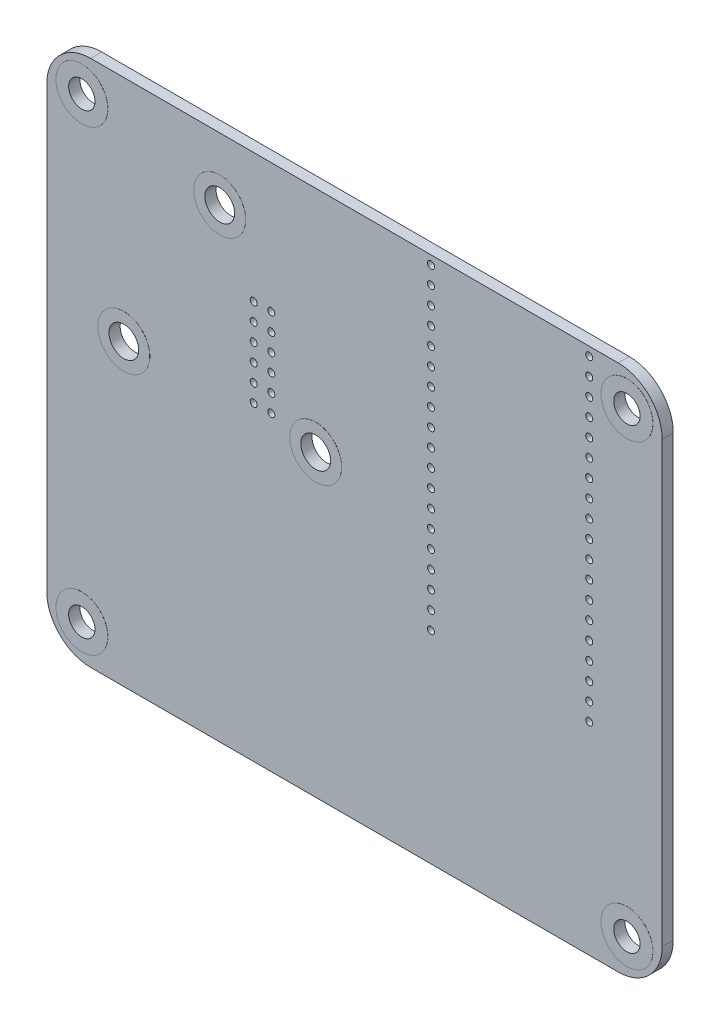
from build123d import *

# Parameters (mm, degrees)
SKETCH1_W           = 88.9
SKETCH1_H           = 76.2
BOSS_EXTRUDE1_DEPTH = 1.6
SKETCH2_R           = 2.15
CUT_EXTRUDE1_DEPTH  = 118.099146026
SKETCH4_R           = 1.905
CUT_EXTRUDE2_DEPTH  = 118.099146026
FILLET1_R           = 6.35
BOSS_EXTRUDE2_START = 0.01
SKETCH6_R           = 3.75
SKETCH6_R_2         = 1.905
SKETCH6_R_3         = 2.15
BOSS_EXTRUDE2_DEPTH = 0.01
SKETCH7_R           = 0.508
CUT_EXTRUDE3_DEPTH  = 118.099283089


with BuildPart() as part:
    # Sketch1 → Boss-Extrude1 (new body)
    with BuildSketch(Plane.XY):
        with Locations((44.45, -38.1)):
            Rectangle(SKETCH1_W, SKETCH1_H)
    extrude(amount=BOSS_EXTRUDE1_DEPTH)

    # Sketch2 → Cut-Extrude1 (cut, through all)
    with BuildSketch(Plane(origin=(0, 0, 0), x_dir=(-1, 0, 0), z_dir=(0, 0, -1))):
        with Locations((-38.856406461, -33)):
            Circle(SKETCH2_R)
        with Locations((-11.143593539, -33)):
            Circle(SKETCH2_R)
        with Locations((-25, -9)):
            Circle(SKETCH2_R)
    extrude(amount=-CUT_EXTRUDE1_DEPTH, mode=Mode.SUBTRACT)

    # Sketch4 → Cut-Extrude2 (cut, through all)
    with BuildSketch(Plane(origin=(0, 0, 0), x_dir=(-1, 0, 0), z_dir=(0, 0, -1))):
        with Locations((-5.08, -5.08)):
            Circle(SKETCH4_R)
        with Locations((-83.82, -5.08)):
            Circle(SKETCH4_R)
        with Locations((-83.82, -71.12)):
            Circle(SKETCH4_R)
        with Locations((-5.08, -71.12)):
            Circle(SKETCH4_R)
    extrude(amount=-CUT_EXTRUDE2_DEPTH, mode=Mode.SUBTRACT)

    # Fillet1
    fillet1_edges = [part.edges().sort_by_distance(p)[0] for p in [
        (88.9, 0, 0.8),
        (88.9, -76.2, 0.8),
        (0, -76.2, 0.8),
        (0, 0, 0.8),
    ]]
    fillet(fillet1_edges, radius=FILLET1_R)

    # Sketch6 → Boss-Extrude2 (add)
    # profile 1 of 7: a face of its own
    with BuildSketch(Plane(origin=(0, 0, 0), x_dir=(-1, 0, 0), z_dir=(0, 0, -1)).offset(BOSS_EXTRUDE2_START)):
        with Locations((-5.08, -71.12)):
            Circle(SKETCH6_R)
        with Locations((-5.08, -71.12)):
            Circle(SKETCH6_R_2, mode=Mode.SUBTRACT)
    # profile 2 of 7: a face of its own
    with BuildSketch(Plane(origin=(0, 0, 0), x_dir=(-1, 0, 0), z_dir=(0, 0, -1)).offset(BOSS_EXTRUDE2_START)):
        with Locations((-5.08, -5.08)):
            Circle(SKETCH6_R)
        with Locations((-5.08, -5.08)):
            Circle(SKETCH6_R_2, mode=Mode.SUBTRACT)
    # profile 3 of 7: a face of its own
    with BuildSketch(Plane(origin=(0, 0, 0), x_dir=(-1, 0, 0), z_dir=(0, 0, -1)).offset(BOSS_EXTRUDE2_START)):
        with Locations((-11.143593539, -33)):
            Circle(SKETCH6_R)
        with Locations((-11.143593539, -33)):
            Circle(SKETCH6_R_3, mode=Mode.SUBTRACT)
    # profile 4 of 7: a face of its own
    with BuildSketch(Plane(origin=(0, 0, 0), x_dir=(-1, 0, 0), z_dir=(0, 0, -1)).offset(BOSS_EXTRUDE2_START)):
        with Locations((-38.856406461, -33)):
            Circle(SKETCH6_R)
        with Locations((-38.856406461, -33)):
            Circle(SKETCH6_R_3, mode=Mode.SUBTRACT)
    # profile 5 of 7: a face of its own
    with BuildSketch(Plane(origin=(0, 0, 0), x_dir=(-1, 0, 0), z_dir=(0, 0, -1)).offset(BOSS_EXTRUDE2_START)):
        with Locations((-25, -9)):
            Circle(SKETCH6_R)
        with Locations((-25, -9)):
            Circle(SKETCH6_R_3, mode=Mode.SUBTRACT)
    # profile 6 of 7: a face of its own
    with BuildSketch(Plane(origin=(0, 0, 0), x_dir=(-1, 0, 0), z_dir=(0, 0, -1)).offset(BOSS_EXTRUDE2_START)):
        with Locations((-83.82, -5.08)):
            Circle(SKETCH6_R)
        with Locations((-83.82, -5.08)):
            Circle(SKETCH6_R_2, mode=Mode.SUBTRACT)
    # profile 7 of 7: a face of its own
    with BuildSketch(Plane(origin=(0, 0, 0), x_dir=(-1, 0, 0), z_dir=(0, 0, -1)).offset(BOSS_EXTRUDE2_START)):
        with Locations((-83.82, -71.12)):
            Circle(SKETCH6_R)
        with Locations((-83.82, -71.12)):
            Circle(SKETCH6_R_2, mode=Mode.SUBTRACT)
    boss_extrude2 = extrude(amount=-BOSS_EXTRUDE2_DEPTH)

    # Mirror1: Boss-Extrude2 across plane
    add(boss_extrude2.mirror(Plane.XY.offset(0.8)))

    # Sketch7 → Cut-Extrude3 (cut, through all)
    with BuildSketch(Plane.XY.offset(1.6)):
        with Locations((78.365824126, -1.253627545)):
            Circle(SKETCH7_R)
        with Locations((29.897, -31.35)):
            Circle(SKETCH7_R)
        with Locations((32.437, -31.35)):
            Circle(SKETCH7_R)
        with Locations((32.437, -28.81)):
            Circle(SKETCH7_R)
        with Locations((32.437, -26.27)):
            Circle(SKETCH7_R)
        with Locations((32.437, -23.73)):
            Circle(SKETCH7_R)
        with Locations((32.437, -21.19)):
            Circle(SKETCH7_R)
        with Locations((32.437, -18.65)):
            Circle(SKETCH7_R)
        with Locations((29.897, -28.81)):
            Circle(SKETCH7_R)
        with Locations((29.897, -26.27)):
            Circle(SKETCH7_R)
        with Locations((29.897, -23.73)):
            Circle(SKETCH7_R)
        with Locations((29.897, -21.19)):
            Circle(SKETCH7_R)
        with Locations((29.897, -18.65)):
            Circle(SKETCH7_R)
        with Locations((55.505824126, -1.253627545)):
            Circle(SKETCH7_R)
        with Locations((55.505824126, -3.793627545)):
            Circle(SKETCH7_R)
        with Locations((55.505824126, -6.333627545)):
            Circle(SKETCH7_R)
        with Locations((55.505824126, -8.873627545)):
            Circle(SKETCH7_R)
        with Locations((55.505824126, -11.413627545)):
            Circle(SKETCH7_R)
        with Locations((55.505824126, -13.953627545)):
            Circle(SKETCH7_R)
        with Locations((55.505824126, -16.493627545)):
            Circle(SKETCH7_R)
        with Locations((55.505824126, -19.033627545)):
            Circle(SKETCH7_R)
        with Locations((55.505824126, -21.573627545)):
            Circle(SKETCH7_R)
        with Locations((55.505824126, -24.113627545)):
            Circle(SKETCH7_R)
        with Locations((55.505824126, -26.653627545)):
            Circle(SKETCH7_R)
        with Locations((55.505824126, -29.193627545)):
            Circle(SKETCH7_R)
        with Locations((55.505824126, -31.733627545)):
            Circle(SKETCH7_R)
        with Locations((55.505824126, -34.273627545)):
            Circle(SKETCH7_R)
        with Locations((55.505824126, -36.813627545)):
            Circle(SKETCH7_R)
        with Locations((55.505824126, -39.353627545)):
            Circle(SKETCH7_R)
        with Locations((55.505824126, -41.893627545)):
            Circle(SKETCH7_R)
        with Locations((55.505824126, -44.433627545)):
            Circle(SKETCH7_R)
        with Locations((55.505824126, -46.973627545)):
            Circle(SKETCH7_R)
        with Locations((78.365824126, -3.793627545)):
            Circle(SKETCH7_R)
        with Locations((78.365824126, -6.333627545)):
            Circle(SKETCH7_R)
        with Locations((78.365824126, -8.873627545)):
            Circle(SKETCH7_R)
        with Locations((78.365824126, -11.413627545)):
            Circle(SKETCH7_R)
        with Locations((78.365824126, -13.953627545)):
            Circle(SKETCH7_R)
        with Locations((78.365824126, -16.493627545)):
            Circle(SKETCH7_R)
        with Locations((78.365824126, -19.033627545)):
            Circle(SKETCH7_R)
        with Locations((78.365824126, -21.573627545)):
            Circle(SKETCH7_R)
        with Locations((78.365824126, -24.113627545)):
            Circle(SKETCH7_R)
        with Locations((78.365824126, -26.653627545)):
            Circle(SKETCH7_R)
        with Locations((78.365824126, -29.193627545)):
            Circle(SKETCH7_R)
        with Locations((78.365824126, -31.733627545)):
            Circle(SKETCH7_R)
        with Locations((78.365824126, -34.273627545)):
            Circle(SKETCH7_R)
        with Locations((78.365824126, -36.813627545)):
            Circle(SKETCH7_R)
        with Locations((78.365824126, -39.353627545)):
            Circle(SKETCH7_R)
        with Locations((78.365824126, -41.893627545)):
            Circle(SKETCH7_R)
        with Locations((78.365824126, -44.433627545)):
            Circle(SKETCH7_R)
        with Locations((78.365824126, -46.973627545)):
            Circle(SKETCH7_R)
    extrude(amount=-CUT_EXTRUDE3_DEPTH, mode=Mode.SUBTRACT)


solid = part.part
